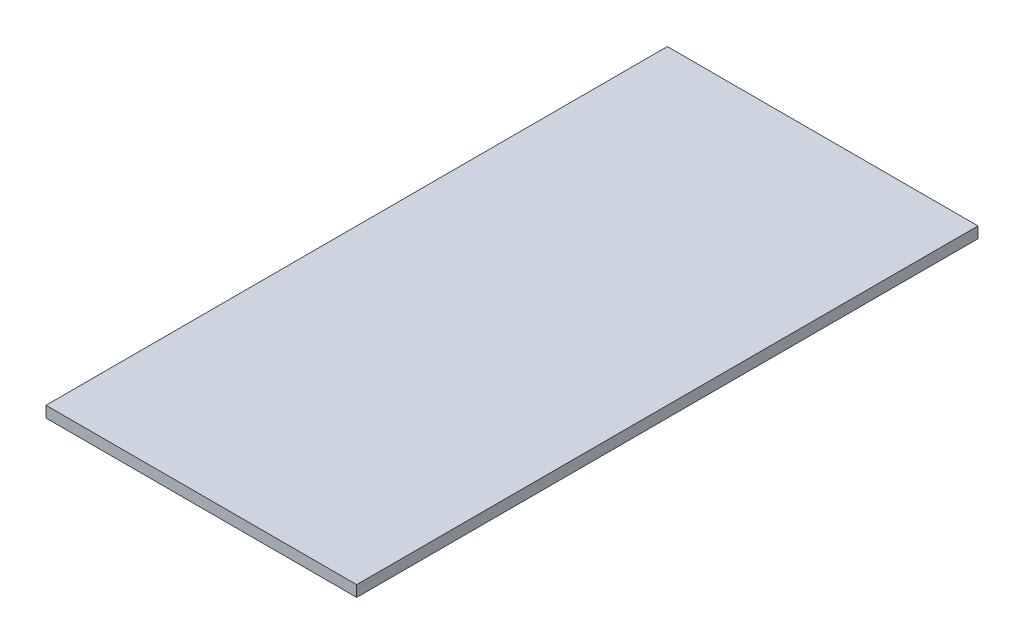
from build123d import *

# Parameters (mm, degrees)
SKETCH1_W           = 177.8
SKETCH1_H           = 355.6
BOSS_EXTRUDE1_DEPTH = 6.35


with BuildPart() as part:
    # Sketch1 → Boss-Extrude1 (new body)
    with BuildSketch(Plane(origin=(0, 0, 0), x_dir=(1, 0, 0), z_dir=(0, 1, 0))):
        Rectangle(SKETCH1_W, SKETCH1_H)
    extrude(amount=BOSS_EXTRUDE1_DEPTH)


solid = part.part
